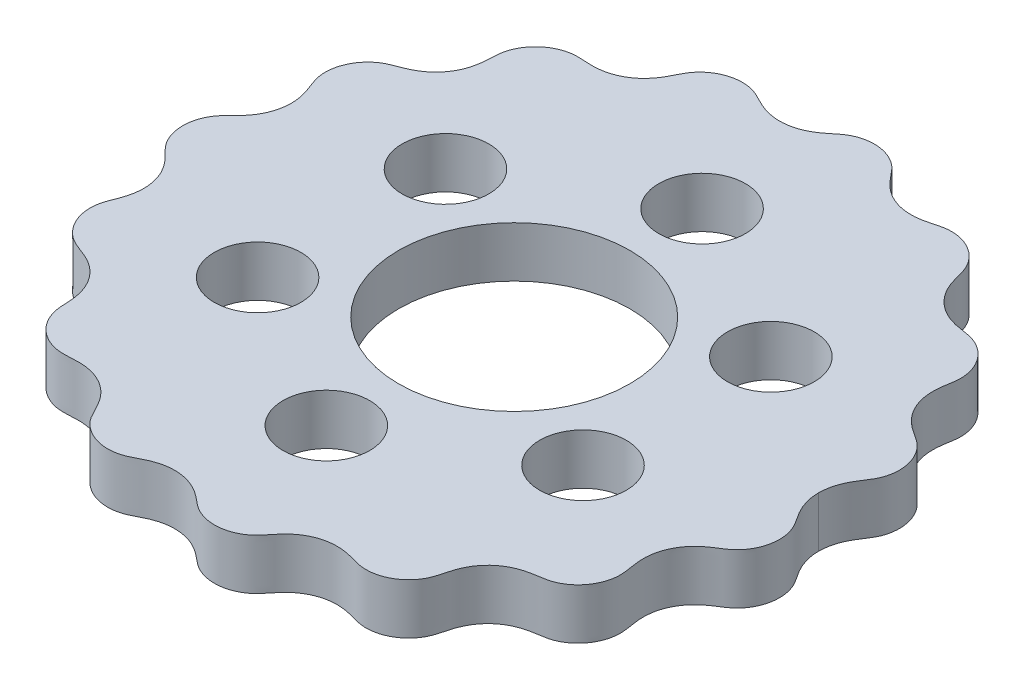
from build123d import *

# Parameters (mm, degrees)
BOSS_EXTRUDE2_DEPTH = 7
SKETCH3_R           = 16
CUT_EXTRUDE1_DEPTH  = 7
SKETCH4_R           = 6
CUT_EXTRUDE2_DEPTH  = 15


with BuildPart() as part:
    # Sketch1 → Boss-Extrude2 (new body)
    with BuildSketch(Plane(origin=(0, 0, 0), x_dir=(1, 0, 0), z_dir=(0, 1, 0))):
        with BuildLine():
            add(Edge.make_bspline(
                [(42.125, 0), (42.125, -0.050111503), (42.125983789, -0.124270601), (42.12926312, -0.263404162), (42.13792177, -0.436685275), (42.150024342, -0.599941433), (42.169084094, -0.793634391), (42.197443247, -1.010142142), (42.24137744, -1.279854125), (42.30737295, -1.601193874), (42.403655947, -1.971550436), (42.538703153, -2.38773821), (42.698275014, -2.794809007), (42.87962644, -3.193107112), (43.136566081, -3.683530217), (43.482023173, -4.259411265), (43.92871296, -4.906534722), (44.409088062, -5.674545683), (44.80069154, -6.610534405), (45.029455243, -7.709312987), (45.029534753, -8.948421147), (44.735154912, -10.269563182), (44.190202388, -11.421206594), (43.461915484, -12.365662153), (42.620606428, -13.077798351), (41.75933588, -13.602023587), (40.782375181, -14.24077648), (39.770007229, -15.106229673), (38.837963121, -16.284059068), (38.140543265, -17.797698433), (37.849843152, -19.283131217), (37.858567691, -20.637700674), (38.027924775, -21.81994745), (38.227896481, -22.839398489), (38.278784676, -23.977926079), (38.061477054, -25.196633739), (37.548930796, -26.412074169), (36.724695784, -27.543582428), (35.747605779, -28.391094306), (34.705958913, -28.960018949), (33.658573874, -29.273780392), (32.670175116, -29.405046423), (31.528626715, -29.583612784), (30.259461435, -29.948065803), (28.926200518, -30.626813715), (27.658979514, -31.710566591), (26.77166441, -32.944665506), (26.211803677, -34.191430537), (25.914456106, -35.224253687), (25.730441994, -35.98946674), (25.503920953, -36.743796735), (25.158634141, -37.555020457), (24.541340328, -38.47852618), (23.56963883, -39.395678127), (22.332838642, -40.109745048), (21.052711008, -40.492687257), (19.944284685, -40.565526519), (19.069100927, -40.458941809), (18.302571468, -40.277949788), (17.547870469, -40.054704157), (16.504745598, -39.795803132), (15.145085042, -39.657274234), (13.63266648, -39.808662197), (12.060498454, -40.364231341), (10.806055064, -41.179495208), (9.855846846, -42.096398076), (9.13042965, -42.995724804), (8.522550537, -43.786070233), (7.727132662, -44.536251545), (6.713605997, -45.1538819), (5.491094241, -45.576310682), (4.099061737, -45.724365083), (2.790186478, -45.560522835), (1.626100623, -45.139363103), (0.66555132, -44.526028546), (-0.117334117, -43.843123009), (-1.056509827, -43.10533103), (-2.22524166, -42.420492426), (-3.657010301, -41.929526929), (-5.31657631, -41.77669476), (-6.802619198, -41.994947328), (-8.058323793, -42.438968534), (-9.099952236, -42.965644965), (-9.984628914, -43.4494492), (-11.021932951, -43.821920614), (-12.204123187, -43.98049544), (-13.490139521, -43.875132472), (-14.81219949, -43.455007935), (-15.930096, -42.792763223), (-16.812682626, -41.965105098), (-17.444644159, -41.05067926), (-17.87884404, -40.138681571), (-18.416286752, -39.084031302), (-19.187736765, -37.958724796), (-20.298532637, -36.882006518), (-21.791488269, -36.020048182), (-23.279351586, -35.596429877), (-24.639620614, -35.490987822), (-25.821695895, -35.552873915), (-26.828609002, -35.632844632), (-27.936505774, -35.542762809), (-29.094572049, -35.192249433), (-30.227041049, -34.555245012), (-31.251909555, -33.620369761), (-31.986164729, -32.559328431), (-32.439930019, -31.456234241), (-32.636012331, -30.371666887), (-32.659363911, -29.363612292), (-32.724062966, -28.198197383), (-32.967381615, -26.888714701), (-33.521390797, -25.492637526), (-34.483530334, -24.131827286), (-35.62460326, -23.137362022), (-36.802056783, -22.467629861), (-37.910591272, -22.023175837), (-38.893447469, -21.686629913), (-39.904885532, -21.161437119), (-40.851663321, -20.363889021), (-41.647992768, -19.312290986), (-42.215789721, -18.03272817), (-42.461212215, -16.762787706), (-42.433090892, -15.576232426), (-42.181125567, -14.512290126), (-41.800602428, -13.590677807), (-41.384477805, -12.512786336), (-41.065509427, -11.231427642), (-40.986709416, -9.737420314), (-41.291629975, -8.098091172), (-41.862307833, -6.833333601), (-42.485030512, -5.925112529), (-43.012487758, -5.308542849), (-43.373569026, -4.927518135), (-43.747612752, -4.559502393), (-44.123119393, -4.192996976), (-44.482901085, -3.810539478), (-44.810498179, -3.39968199), (-45.074449616, -2.995489006), (-45.282501511, -2.608052654), (-45.443968601, -2.245566431), (-45.567566894, -1.913767675), (-45.657733049, -1.617374758), (-45.722140257, -1.359838316), (-45.767227545, -1.143274187), (-45.798143564, -0.969101122), (-45.823906474, -0.794103403), (-45.84193994, -0.639601929), (-45.85417666, -0.508660477), (-45.862227008, -0.399577861), (-45.867379177, -0.309980064), (-45.872209294, -0.192863551), (-45.874355991, -0.094919655), (-45.875, -0.037962255), (-45.875, 0)],
                knots=[0.069179893, 0.069179893, 0.069179893, 0.069179893, 0.069179893, 0.070492423, 0.071148688, 0.071804953, 0.073033404, 0.074261856, 0.075490307, 0.076718758, 0.07917566, 0.081632563, 0.084089465, 0.086546368, 0.08900327, 0.091460173, 0.096539164, 0.101618155, 0.106697146, 0.111776138, 0.119230006, 0.126683875, 0.134323335, 0.141962795, 0.14762522, 0.153287644, 0.158950069, 0.164612494, 0.173852333, 0.183092172, 0.192407893, 0.201723615, 0.207559441, 0.213395267, 0.219231093, 0.225066919, 0.233023714, 0.240980509, 0.248620155, 0.256259802, 0.261857538, 0.267455275, 0.273053011, 0.278650747, 0.287827807, 0.297004866, 0.306390436, 0.315776006, 0.321674031, 0.327572056, 0.330521069, 0.333470081, 0.339368106, 0.347322622, 0.355277139, 0.363231655, 0.371186171, 0.377084196, 0.380033209, 0.382982221, 0.388880247, 0.394778272, 0.404163841, 0.413549411, 0.422726471, 0.43190353, 0.437501266, 0.443099003, 0.448696739, 0.454294476, 0.461934122, 0.469573768, 0.477530563, 0.485487359, 0.491323185, 0.497159011, 0.502994837, 0.508830663, 0.518146384, 0.527462106, 0.536701945, 0.545941784, 0.551604208, 0.557266633, 0.562929058, 0.568591482, 0.576230942, 0.583870402, 0.591690813, 0.599511223, 0.605182361, 0.610853499, 0.616524636, 0.622195774, 0.631785081, 0.641374388, 0.650963696, 0.660553003, 0.66622414, 0.671895278, 0.677566416, 0.683237554, 0.691057964, 0.698878375, 0.706517835, 0.714157295, 0.719819719, 0.725482144, 0.731144568, 0.736806993, 0.746046832, 0.755286671, 0.764602392, 0.773918114, 0.77975394, 0.785589766, 0.791425592, 0.797261418, 0.805218213, 0.813175008, 0.820814655, 0.828454301, 0.834052038, 0.839649774, 0.84524751, 0.850845247, 0.860022306, 0.869199366, 0.878584935, 0.887970505, 0.890919518, 0.89386853, 0.896817543, 0.899766555, 0.902715568, 0.905664581, 0.908613593, 0.911562606, 0.913551235, 0.915539864, 0.917528493, 0.919517122, 0.920511436, 0.921505751, 0.922500065, 0.92349438, 0.924488695, 0.924985852, 0.925483009, 0.925980166, 0.926477324, 0.927471638, 0.927471638, 0.927471638, 0.927471638, 0.927471638], degree=4))
            add(Edge.make_bspline(
                [(42.125, 0), (42.125, 0.050111503), (42.125983789, 0.124270601), (42.12926312, 0.263404162), (42.13792177, 0.436685275), (42.150024342, 0.599941433), (42.169084094, 0.793634391), (42.197443247, 1.010142142), (42.24137744, 1.279854125), (42.30737295, 1.601193874), (42.403655947, 1.971550436), (42.538703153, 2.38773821), (42.698275014, 2.794809007), (42.87962644, 3.193107112), (43.136566081, 3.683530217), (43.482023173, 4.259411265), (43.92871296, 4.906534722), (44.409088062, 5.674545683), (44.80069154, 6.610534405), (45.029455243, 7.709312987), (45.029534753, 8.948421147), (44.735154912, 10.269563182), (44.190202389, 11.421206594), (43.461915484, 12.365662153), (42.620606429, 13.077798351), (41.75933588, 13.602023587), (40.782375181, 14.24077648), (39.770007229, 15.106229673), (38.837963121, 16.284059068), (38.140543265, 17.797698433), (37.849843152, 19.283131217), (37.858567691, 20.637700674), (38.027924775, 21.81994745), (38.227896482, 22.839398489), (38.278784676, 23.977926079), (38.061477054, 25.196633739), (37.548930797, 26.412074169), (36.724695784, 27.543582428), (35.74760578, 28.391094307), (34.705958913, 28.960018949), (33.658573874, 29.273780392), (32.670175116, 29.405046423), (31.528626715, 29.583612784), (30.259461435, 29.948065803), (28.926200518, 30.626813715), (27.658979514, 31.710566591), (26.77166441, 32.944665506), (26.211803677, 34.191430537), (25.914456106, 35.224253687), (25.730441995, 35.98946674), (25.503920953, 36.743796735), (25.158634141, 37.555020457), (24.541340328, 38.47852618), (23.56963883, 39.395678127), (22.332838643, 40.109745048), (21.052711008, 40.492687257), (19.944284685, 40.565526519), (19.069100927, 40.458941809), (18.302571469, 40.277949788), (17.54787047, 40.054704157), (16.504745599, 39.795803132), (15.145085042, 39.657274234), (13.63266648, 39.808662197), (12.060498454, 40.364231341), (10.806055064, 41.179495208), (9.855846846, 42.096398076), (9.13042965, 42.995724804), (8.522550538, 43.786070233), (7.727132662, 44.536251545), (6.713605997, 45.1538819), (5.491094241, 45.576310682), (4.099061738, 45.724365083), (2.790186478, 45.560522835), (1.626100623, 45.139363104), (0.66555132, 44.526028546), (-0.117334117, 43.84312301), (-1.056509827, 43.10533103), (-2.225241659, 42.420492427), (-3.6570103, 41.929526929), (-5.316576309, 41.77669476), (-6.802619198, 41.994947328), (-8.058323792, 42.438968534), (-9.099952235, 42.965644965), (-9.984628914, 43.4494492), (-11.021932951, 43.821920615), (-12.204123187, 43.98049544), (-13.49013952, 43.875132472), (-14.812199489, 43.455007936), (-15.930096, 42.792763224), (-16.812682626, 41.965105098), (-17.444644159, 41.05067926), (-17.87884404, 40.138681571), (-18.416286752, 39.084031303), (-19.187736765, 37.958724796), (-20.298532637, 36.882006519), (-21.791488269, 36.020048183), (-23.279351586, 35.596429878), (-24.639620614, 35.490987822), (-25.821695895, 35.552873915), (-26.828609002, 35.632844632), (-27.936505774, 35.542762809), (-29.094572049, 35.192249433), (-30.227041049, 34.555245012), (-31.251909554, 33.620369762), (-31.986164729, 32.559328431), (-32.439930019, 31.456234242), (-32.636012331, 30.371666887), (-32.659363911, 29.363612292), (-32.724062965, 28.198197384), (-32.967381615, 26.888714702), (-33.521390797, 25.492637526), (-34.483530334, 24.131827286), (-35.62460326, 23.137362022), (-36.802056783, 22.467629861), (-37.910591272, 22.023175837), (-38.893447469, 21.686629913), (-39.904885532, 21.161437119), (-40.851663321, 20.363889022), (-41.647992768, 19.312290986), (-42.215789721, 18.032728171), (-42.461212215, 16.762787706), (-42.433090892, 15.576232426), (-42.181125567, 14.512290127), (-41.800602428, 13.590677808), (-41.384477805, 12.512786336), (-41.065509427, 11.231427643), (-40.986709416, 9.737420314), (-41.291629975, 8.098091172), (-41.862307833, 6.833333601), (-42.485030512, 5.92511253), (-43.012487758, 5.308542849), (-43.373569026, 4.927518136), (-43.747612752, 4.559502393), (-44.123119393, 4.192996977), (-44.482901085, 3.810539479), (-44.810498179, 3.399681991), (-45.074449616, 2.995489007), (-45.282501511, 2.608052654), (-45.443968601, 2.245566431), (-45.567566894, 1.913767676), (-45.657733049, 1.617374758), (-45.722140257, 1.359838317), (-45.767227545, 1.143274188), (-45.798143564, 0.969101122), (-45.823906474, 0.794103403), (-45.84193994, 0.639601929), (-45.85417666, 0.508660478), (-45.862227008, 0.399577861), (-45.867379177, 0.309980064), (-45.872209294, 0.192863551), (-45.874355991, 0.094919655), (-45.875, 0.037962256), (-45.875, 0)],
                knots=[0.069179893, 0.069179893, 0.069179893, 0.069179893, 0.069179893, 0.070492423, 0.071148688, 0.071804953, 0.073033404, 0.074261856, 0.075490307, 0.076718758, 0.07917566, 0.081632563, 0.084089465, 0.086546368, 0.08900327, 0.091460173, 0.096539164, 0.101618155, 0.106697146, 0.111776138, 0.119230006, 0.126683875, 0.134323335, 0.141962795, 0.14762522, 0.153287644, 0.158950069, 0.164612494, 0.173852333, 0.183092172, 0.192407893, 0.201723615, 0.207559441, 0.213395267, 0.219231093, 0.225066919, 0.233023714, 0.240980509, 0.248620155, 0.256259802, 0.261857538, 0.267455275, 0.273053011, 0.278650747, 0.287827807, 0.297004866, 0.306390436, 0.315776006, 0.321674031, 0.327572056, 0.330521069, 0.333470081, 0.339368106, 0.347322622, 0.355277139, 0.363231655, 0.371186171, 0.377084196, 0.380033209, 0.382982221, 0.388880247, 0.394778272, 0.404163841, 0.413549411, 0.422726471, 0.43190353, 0.437501266, 0.443099003, 0.448696739, 0.454294476, 0.461934122, 0.469573768, 0.477530563, 0.485487359, 0.491323185, 0.497159011, 0.502994837, 0.508830663, 0.518146384, 0.527462106, 0.536701945, 0.545941784, 0.551604208, 0.557266633, 0.562929058, 0.568591482, 0.576230942, 0.583870402, 0.591690813, 0.599511223, 0.605182361, 0.610853499, 0.616524636, 0.622195774, 0.631785081, 0.641374388, 0.650963696, 0.660553003, 0.66622414, 0.671895278, 0.677566416, 0.683237554, 0.691057964, 0.698878375, 0.706517835, 0.714157295, 0.719819719, 0.725482144, 0.731144568, 0.736806993, 0.746046832, 0.755286671, 0.764602392, 0.773918114, 0.77975394, 0.785589766, 0.791425592, 0.797261418, 0.805218213, 0.813175008, 0.820814655, 0.828454301, 0.834052038, 0.839649774, 0.84524751, 0.850845247, 0.860022306, 0.869199366, 0.878584935, 0.887970505, 0.890919518, 0.89386853, 0.896817543, 0.899766555, 0.902715568, 0.905664581, 0.908613593, 0.911562606, 0.913551235, 0.915539864, 0.917528493, 0.919517122, 0.920511436, 0.921505751, 0.922500065, 0.92349438, 0.924488695, 0.924985852, 0.925483009, 0.925980166, 0.926477324, 0.927471638, 0.927471638, 0.927471638, 0.927471638, 0.927471638], degree=4))
        make_face()
    extrude(amount=BOSS_EXTRUDE2_DEPTH)

    # Sketch3 → Cut-Extrude1 (cut)
    with BuildSketch(Plane(origin=(0, 7, 0), x_dir=(1, 0, 0), z_dir=(0, 1, 0))):
        Circle(SKETCH3_R)
    extrude(amount=-CUT_EXTRUDE1_DEPTH, mode=Mode.SUBTRACT)

    # Sketch4 → Cut-Extrude2 (cut)
    with BuildSketch(Plane(origin=(0, 7, 0), x_dir=(1, 0, 0), z_dir=(0, 1, 0))):
        with Locations((0, 26)):
            Circle(SKETCH4_R)
        with Locations((22.516660498, 13)):
            Circle(SKETCH4_R)
        with Locations((22.516660498, -13)):
            Circle(SKETCH4_R)
        with Locations((0, -26)):
            Circle(SKETCH4_R)
        with Locations((-22.516660498, -13)):
            Circle(SKETCH4_R)
        with Locations((-22.516660498, 13)):
            Circle(SKETCH4_R)
    extrude(amount=-CUT_EXTRUDE2_DEPTH, mode=Mode.SUBTRACT)


solid = part.part
